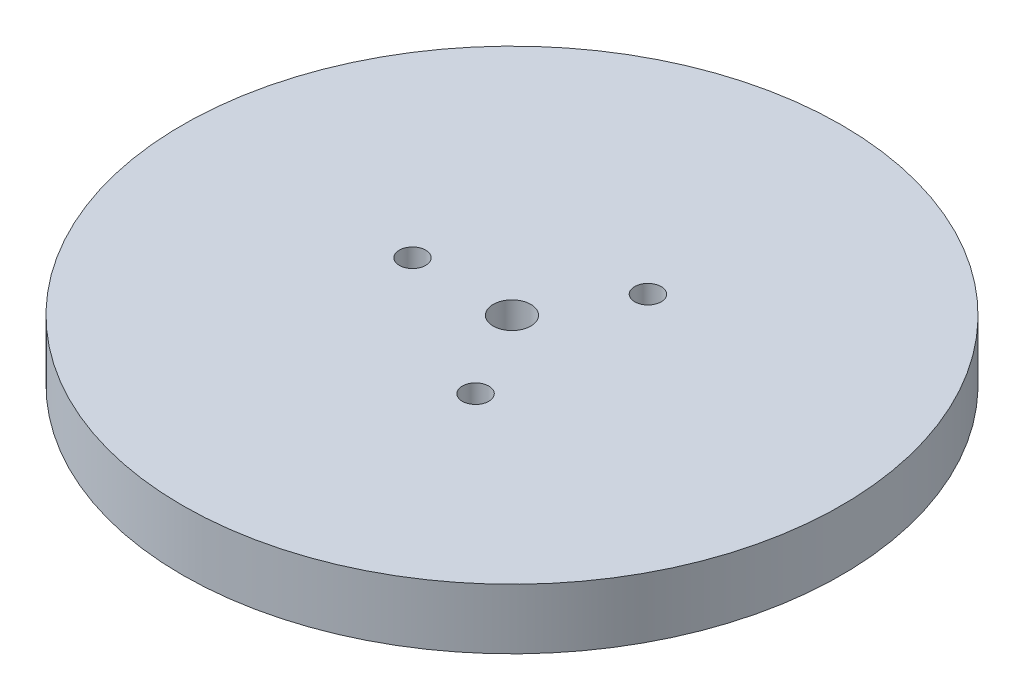
from build123d import *

# Parameters (mm, degrees)
SKETCH1_R           = 87.5
BOSS_EXTRUDE1_DEPTH = 16
SKETCH2_R           = 5
CUT_EXTRUDE1_DEPTH  = 125.773795326
SKETCH3_R           = 3.515018004
CUT_EXTRUDE2_DEPTH  = 13.960056072
CIRPATTERN1_COUNT   = 3


with BuildPart() as part:
    # Sketch1 → Boss-Extrude1 (new body)
    with BuildSketch(Plane(origin=(0, 0, 0), x_dir=(1, 0, 0), z_dir=(0, 1, 0))):
        Circle(SKETCH1_R)
    extrude(amount=BOSS_EXTRUDE1_DEPTH)

    # Sketch2 → Cut-Extrude1 (cut, through all)
    with BuildSketch(Plane(origin=(0, 0, 0), x_dir=(1, 0, 0), z_dir=(0, 1, 0))):
        Circle(SKETCH2_R)
    extrude(amount=CUT_EXTRUDE1_DEPTH, mode=Mode.SUBTRACT)

    # Sketch3 → Cut-Extrude2 (cut)
    with BuildSketch(Plane(origin=(0, 16, 0), x_dir=(1, 0, 0), z_dir=(0, 1, 0))):
        with Locations((-26.41783364, 0)):
            Circle(SKETCH3_R)
    cut_extrude2 = extrude(amount=-CUT_EXTRUDE2_DEPTH, mode=Mode.SUBTRACT)

    # CirPattern1: Cut-Extrude2 ×3 about axis
    cirpattern1_axis = Axis((0, 0, 0), (0, 1, 0))
    for i in range(1, CIRPATTERN1_COUNT):
        add(cut_extrude2.rotate(cirpattern1_axis, i * 360 / CIRPATTERN1_COUNT), mode=Mode.SUBTRACT)


solid = part.part
